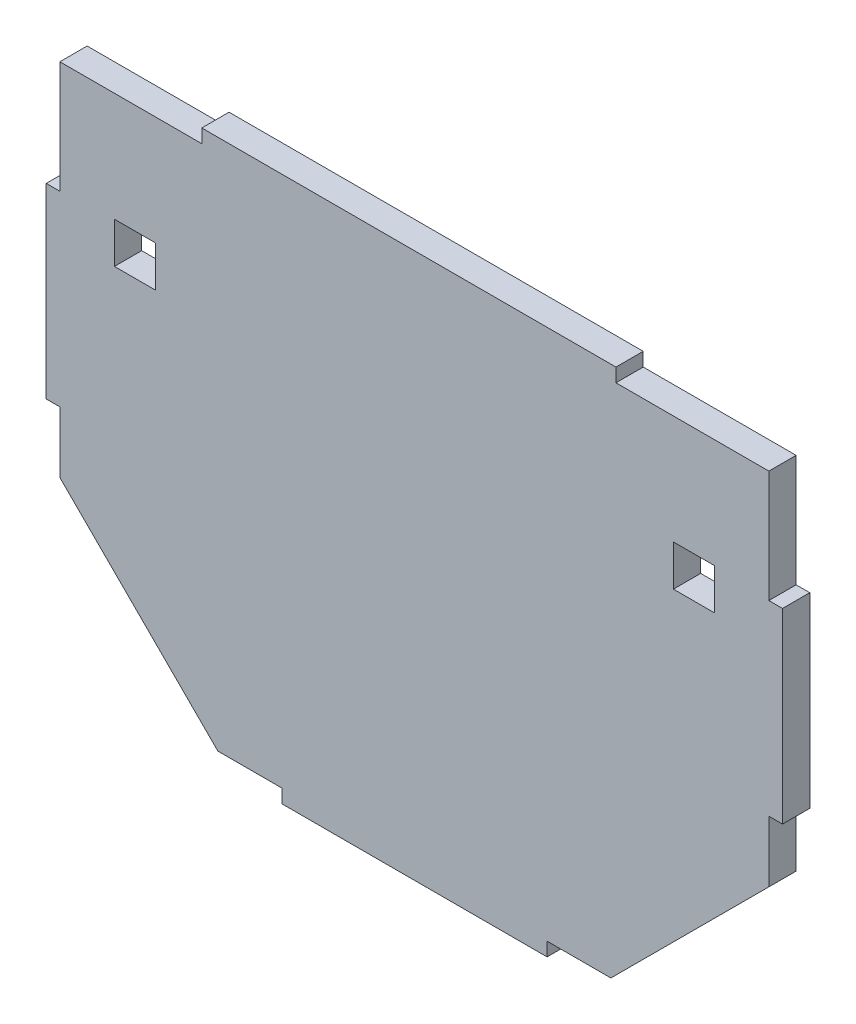
from build123d import *

# Parameters (mm, degrees)
BOSS_EXTRUDE1_DEPTH = 12.7
SKETCH2_W           = 19.05
SKETCH2_H           = 19.05
CUT_EXTRUDE1_DEPTH  = 1311.197009113


with BuildPart() as part:
    # Sketch1 → Boss-Extrude1 (new body)
    with BuildSketch(Plane.XY):
        Polygon((424.715446324, 892.207843626), (424.715446324, 920.715652439), (418.365446324, 920.715652439), (418.365446324, 1007.691853389), (424.715446324, 1007.691853389), (424.715446324, 1059.919118431), (490.806723979, 1059.919118431), (490.806723979, 1066.269118431), (683.70003755, 1066.269118431), (683.70003755, 1059.919118431), (754.915446324, 1059.919118431), (754.915446324, 1007.691853389), (761.265446324, 1007.691853389), (761.265446324, 920.715652439), (754.915446324, 920.715652439), (754.915446324, 892.207843626), (681.331146762, 818.667305174), (651.634447679, 818.667305174), (651.634447679, 812.317305174), (528.064815274, 812.317305174), (528.064815274, 818.667305174), (498.299745887, 818.667305174), align=None)
    extrude(amount=BOSS_EXTRUDE1_DEPTH)

    # Sketch2 → Cut-Extrude1 (cut, through all)
    with BuildSketch(Plane.XY.offset(12.7)):
        with Locations((459.640446324, 999.594118431)):
            Rectangle(SKETCH2_W, SKETCH2_H)
        with Locations((719.990446324, 999.594118431)):
            Rectangle(SKETCH2_W, SKETCH2_H)
    extrude(amount=-CUT_EXTRUDE1_DEPTH, mode=Mode.SUBTRACT)


solid = part.part
